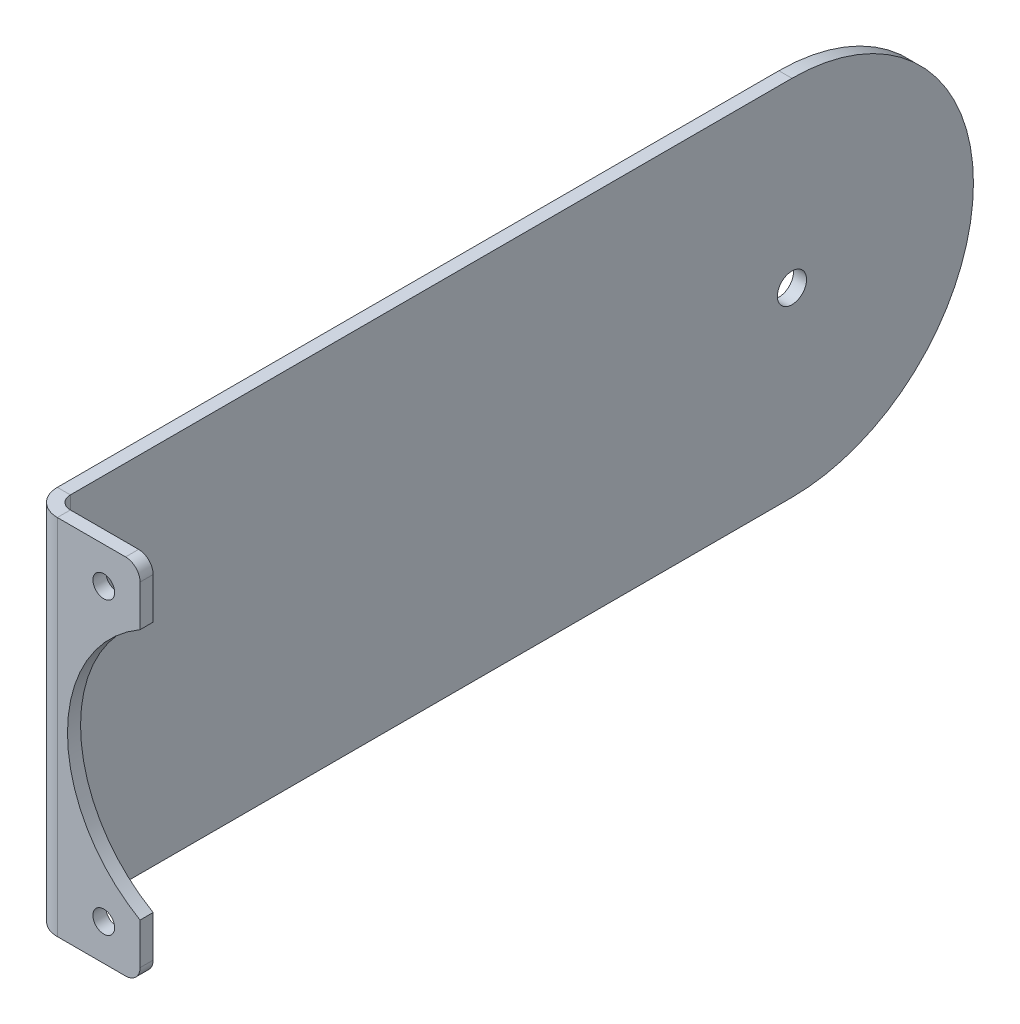
from build123d import *

# Parameters (mm, degrees)
BASE_FLANGE1_DEPTH           = 31.75
SKETCH6_R                    = 25.4
CUT_EXTRUDE1_DEPTH           = 166.905219101
FILLET1_R                    = 2.54
CUT_EXTRUDE2_DEPTH           = 90.31631094
F_7_0_201_DIAMETER_HOLE1_D   = 5.1054
F_25_0_1495_DIAMETER_HOLE1_D = 3.7973


# Sheet-metal steps are written as plain solids
with BuildPart() as part:
    # Sketch1 → Base-Flange1 (new, symmetric)
    with BuildSketch(Plane(origin=(0, 0, 0), x_dir=(-1, 0, 0), z_dir=(0, 1, 0))):
        with BuildLine():
            Line((9.525, -81.28), (9.525, 76.708))
            ThreePointArc((9.525, 76.708), (8.185892204, 79.940892204), (4.953, 81.28))
            Line((4.953, 81.28), (-9.525, 81.28))
            Line((-9.525, 81.28), (-9.525, 78.994))
            Line((-9.525, 78.994), (4.953, 78.994))
            ThreePointArc((4.953, 78.994), (6.569446102, 78.324446102), (7.239, 76.708))
            Line((7.239, 76.708), (7.239, -81.28))
            Line((7.239, -81.28), (9.525, -81.28))
        make_face()
    extrude(amount=BASE_FLANGE1_DEPTH, both=True)

    # Sketch6 → Cut-Extrude1 (cut, through all)
    with BuildSketch(Plane.XY.offset(81.28)):
        with Locations((22.225, 0)):
            Circle(SKETCH6_R)
    extrude(amount=-CUT_EXTRUDE1_DEPTH, mode=Mode.SUBTRACT)

    # Fillet1
    fillet1_edges = [part.edges().sort_by_distance(p)[0] for p in [
        (9.525, 31.75, 80.137),
        (9.525, -31.75, 80.137),
    ]]
    fillet(fillet1_edges, radius=FILLET1_R)

    # Sketch7 → Cut-Extrude2 (cut, through all)
    with BuildSketch(Plane(origin=(-9.525, 0, 0), x_dir=(0, -1, 0), z_dir=(-1, 0, 0))):
        with BuildLine():
            Line((-31.75, -49.53), (-31.75, -100.33))
            Line((-31.75, -100.33), (31.75, -100.33))
            Line((31.75, -100.33), (31.75, -49.53))
            ThreePointArc((31.75, -49.53), (0, -81.28), (-31.75, -49.53))
        make_face()
    extrude(amount=-CUT_EXTRUDE2_DEPTH, mode=Mode.SUBTRACT)

    # #7 (0.201) Diameter Hole1 (through all)
    with Locations(Plane.ZY.offset(9.525)):
        with Locations((-49.53, 0)):
            Hole(F_7_0_201_DIAMETER_HOLE1_D / 2)

    # #25 (0.1495) Diameter Hole1 (through all)
    with Locations(Plane.XY.offset(81.28)):
        with Locations((3.175, 25.4), (3.175, -25.4)):
            Hole(F_25_0_1495_DIAMETER_HOLE1_D / 2)


solid = part.part
